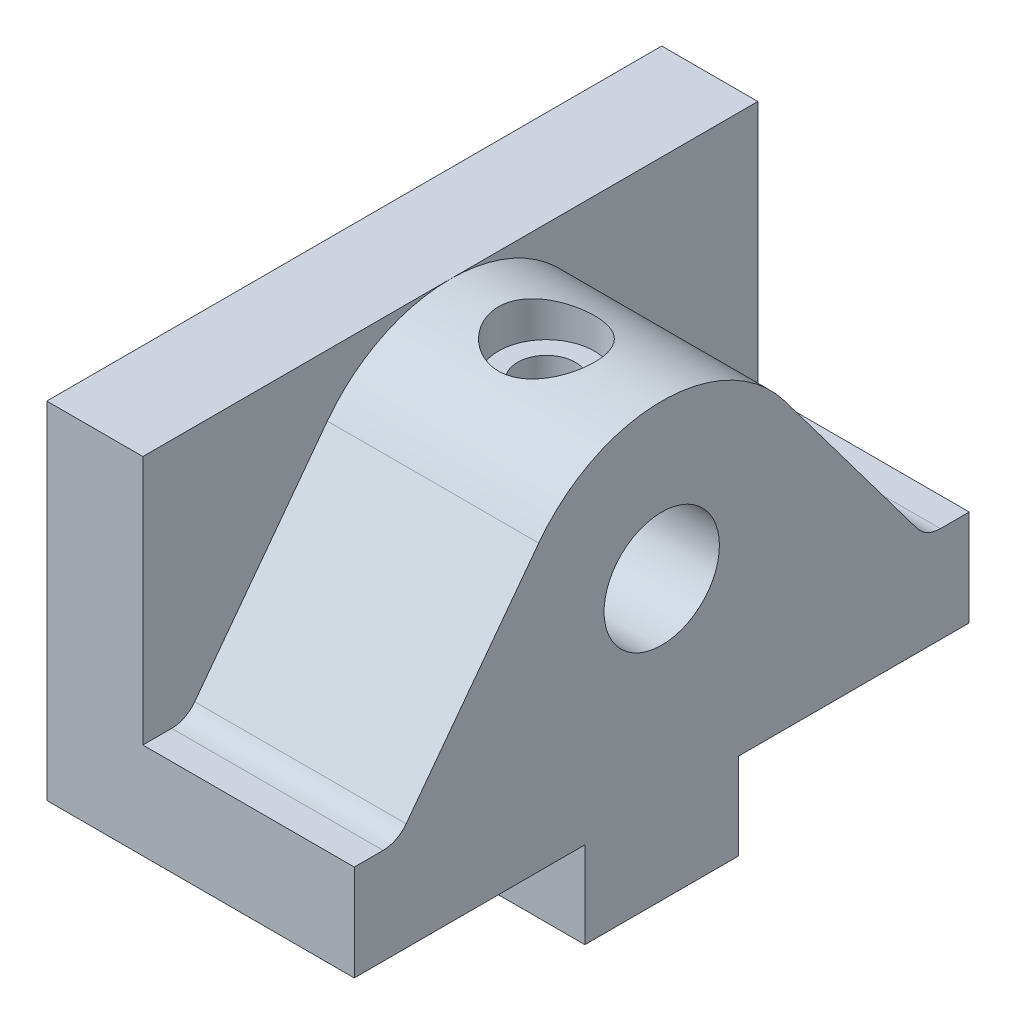
from build123d import *

# Parameters (mm, degrees)
BOSS_EXTRUDE1_DEPTH = 10
BOSS_EXTRUDE2_DEPTH = 22
SKETCH4_R           = 6
CUT_EXTRUDE1_DEPTH  = 24
LPATTERN1_COUNT     = 2
LPATTERN1_PITCH     = 16
FILLET1_R           = 3


# Read off the part's stored shape, not the designer's step: CBORE for M5 Hex Head Bolt1
with BuildPart() as part:
    # Sketch2 → Boss-Extrude1 (new body)
    with BuildSketch(Plane(origin=(0, 0, 0), x_dir=(0, 0, -1), z_dir=(1, 0, 0))):
        Polygon((-32, 45), (32, 45), (32, 9), (8, 9), (8, 0), (-8, 0), (-8, 9), (-32, 9), align=None)
    extrude(amount=BOSS_EXTRUDE1_DEPTH)

    # Sketch3 → Boss-Extrude2 (add)
    with BuildSketch(Plane(origin=(10, 0, 0), x_dir=(0, 0, -1), z_dir=(1, 0, 0))):
        with BuildLine():
            Line((32, 9), (32, 19))
            Line((32, 19), (27.5, 19))
            Line((27.5, 19), (12.784832124, 38.620207192))
            ThreePointArc((12.784832124, 38.620207192), (-0.012621258, 44.999995012), (-12.799983622, 38.600005212))
            Line((-12.799983622, 38.600005212), (-27.5, 19))
            Line((-27.5, 19), (-32, 19))
            Line((-32, 19), (-32, 9))
            Line((-32, 9), (-8, 9))
            Line((-8, 9), (-8, 0))
            Line((-8, 0), (8, 0))
            Line((8, 0), (8, 9))
            Line((8, 9), (32, 9))
        make_face()
    extrude(amount=BOSS_EXTRUDE2_DEPTH)

    # Sketch4 → Cut-Extrude1 (cut)
    with BuildSketch(Plane(origin=(32, 0, 0), x_dir=(0, 0, -1), z_dir=(1, 0, 0))):
        with Locations((1.247e-05, 29)):
            Circle(SKETCH4_R)
    extrude(amount=-CUT_EXTRUDE1_DEPTH, mode=Mode.SUBTRACT)

    # CBORE for M5 Hex Head Bolt1 outline → CBORE for M5 Hex Head Bolt1 (revolve, cut)
    with BuildSketch(Plane(origin=(20, 0, 0), x_dir=(1, 0, 0), z_dir=(0, 0, 1))):
        Polygon((3, 41), (5, 41), (5, 45.000103402), (0, 45.000103402), (0, 34.195861277), (3, 34.195861277), align=None)
    revolve(axis=Axis((20, 0, 0), (0, 1, 0)), mode=Mode.SUBTRACT)

    # Sketch9 → Ø1.0mm Dowel Hole3 (revolve, cut)
    with BuildSketch(Plane(origin=(24, 0, 0), x_dir=(0, 0, -1), z_dir=(1, 0, 0))):
        Polygon((0, 0), (0, 17.732050808), (3, 16), (3, 0), align=None)
    f_1_0mm_dowel_hole3 = revolve(axis=Axis((24, -6.35, 0), (0, 1, 0)), mode=Mode.SUBTRACT)

    # LPattern1: Ø1.0mm Dowel Hole3 ×2
    with Locations(*[(-i * LPATTERN1_PITCH, 0, 0) for i in range(1, LPATTERN1_COUNT)]):
        add(f_1_0mm_dowel_hole3, mode=Mode.SUBTRACT)

    # Fillet1
    fillet1_edges = [part.edges().sort_by_distance(p)[0] for p in [
        (21, 19, -27.5),
        (21, 19, 27.5),
    ]]
    fillet(fillet1_edges, radius=FILLET1_R)


solid = part.part
